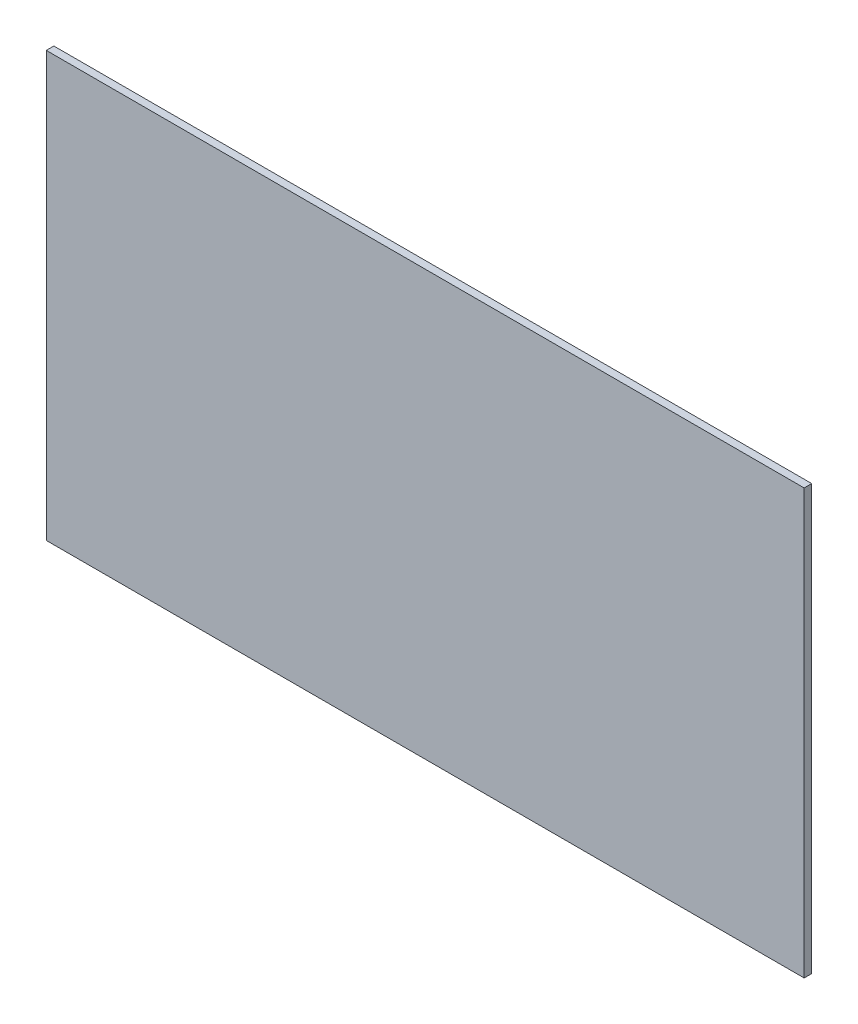
from build123d import *

# Parameters (mm, degrees)
SKETCH1_W           = 317.5
SKETCH1_H           = 177.8
BOSS_EXTRUDE1_DEPTH = 3.175


with BuildPart() as part:
    # Sketch1 → Boss-Extrude1 (new body)
    with BuildSketch(Plane.XY):
        with Locations((158.75, 88.9)):
            Rectangle(SKETCH1_W, SKETCH1_H)
    extrude(amount=BOSS_EXTRUDE1_DEPTH)


solid = part.part
